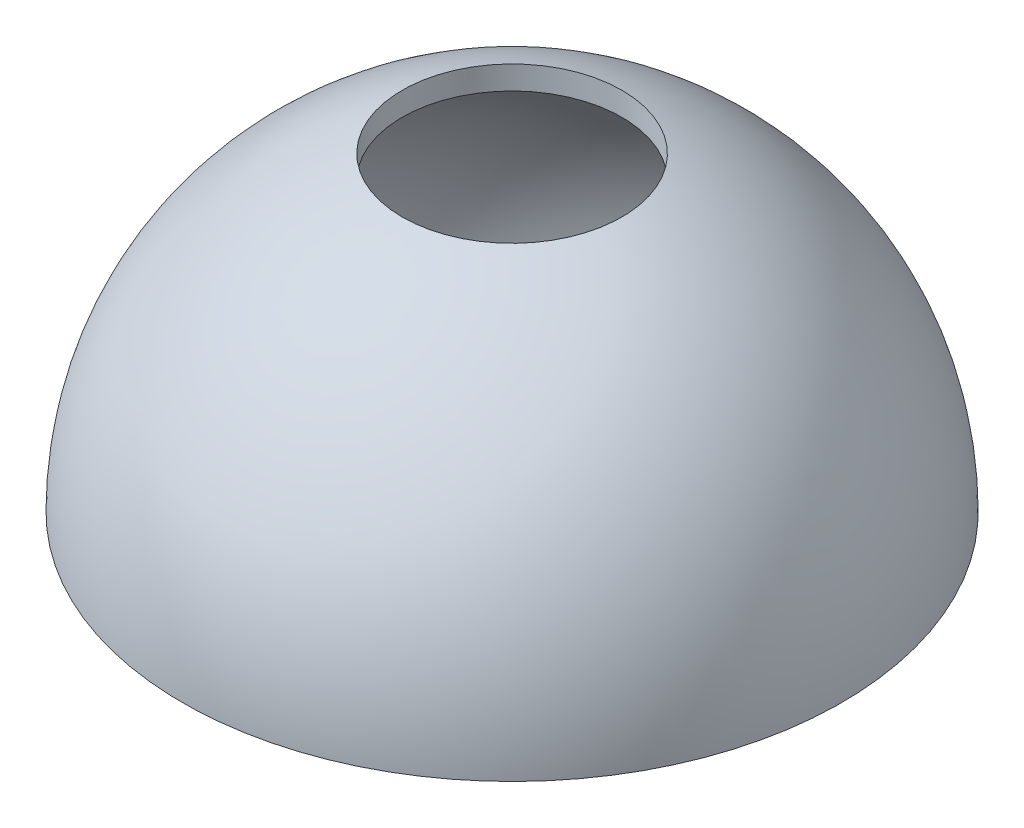
from build123d import *

# Parameters (mm, degrees)
SHELL1_T                = -10
CUT_EXTRUDE3_DEPTH      = 260.807621135
CUT_EXTRUDE3_DEPTH_BACK = 260.807621135
SKETCH2_R               = 50


with BuildPart() as part:
    # Sketch1 → Revolve1 (revolve)
    with BuildSketch(Plane.XY):
        with BuildLine():
            Line((0, 0), (0, 150))
            ThreePointArc((0, 150), (-106.066017178, 106.066017178), (-150, 0))
            Line((-150, 0), (0, 0))
        make_face()
    revolve(axis=Axis((0, 0, 0), (0, 1, 0)))

    # Shell1
    shell1_openings = [part.faces().sort_by_distance(p)[0] for p in [
        (0, 0, 0),
    ]]
    offset(amount=SHELL1_T, openings=shell1_openings, kind=Kind.INTERSECTION)

    # Sketch2 → Cut-Extrude3 (cut, two sides: drawn at the far end of the back side and taken through both)
    with BuildSketch(Plane(origin=(0, 0, 0), x_dir=(1, 0, 0), z_dir=(0, 1, 0)).offset(-CUT_EXTRUDE3_DEPTH_BACK)):
        Circle(SKETCH2_R)
    extrude(amount=CUT_EXTRUDE3_DEPTH + CUT_EXTRUDE3_DEPTH_BACK, mode=Mode.SUBTRACT)


solid = part.part
